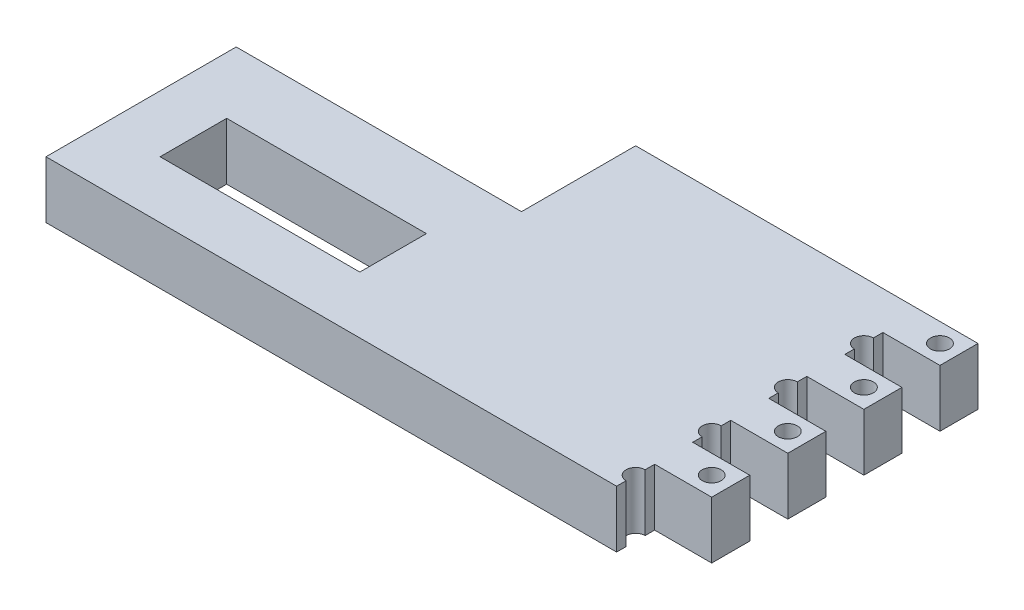
from build123d import *

# Parameters (mm, degrees)
BOSS_EXTRUDE1_DEPTH = 6
SKETCH2_W           = 21
SKETCH2_H           = 7
CUT_EXTRUDE1_DEPTH  = 42.617304093
SKETCH3_R           = 1
CUT_EXTRUDE2_DEPTH  = 42.617304093


with BuildPart() as part:
    # Sketch1 → Boss-Extrude1 (new body)
    with BuildSketch(Plane(origin=(0, 0, 0), x_dir=(1, 0, 0), z_dir=(0, 1, 0))):
        Polygon((-30, 0), (0, 0), (0, 12), (36, 12), (36, 8), (30, 8), (30, 4), (36, 4), (36, 0), (30, 0), (30, -4), (36, -4), (36, -8), (30, -8), (30, -12), (36, -12), (36, -16), (30, -16), (30, -20), (-30, -20), align=None)
    extrude(amount=BOSS_EXTRUDE1_DEPTH)

    # Sketch2 → Cut-Extrude1 (cut, through all)
    with BuildSketch(Plane(origin=(0, 6, 0), x_dir=(1, 0, 0), z_dir=(0, 1, 0))):
        with Locations((-13.5, -10.5)):
            Rectangle(SKETCH2_W, SKETCH2_H)
    extrude(amount=-CUT_EXTRUDE1_DEPTH, mode=Mode.SUBTRACT)

    # Sketch3 → Cut-Extrude2 (cut, through all)
    with BuildSketch(Plane(origin=(0, 6, 0), x_dir=(1, 0, 0), z_dir=(0, 1, 0))):
        with Locations((34, 10)):
            Circle(SKETCH3_R)
        with Locations((34, 2)):
            Circle(SKETCH3_R)
        with Locations((34, -6)):
            Circle(SKETCH3_R)
        with Locations((34, -14)):
            Circle(SKETCH3_R)
        with Locations((30, 6)):
            Circle(SKETCH3_R)
        with Locations((30, -2)):
            Circle(SKETCH3_R)
        with Locations((30, -10)):
            Circle(SKETCH3_R)
        with Locations((30, -18)):
            Circle(SKETCH3_R)
    extrude(amount=-CUT_EXTRUDE2_DEPTH, mode=Mode.SUBTRACT)


solid = part.part
